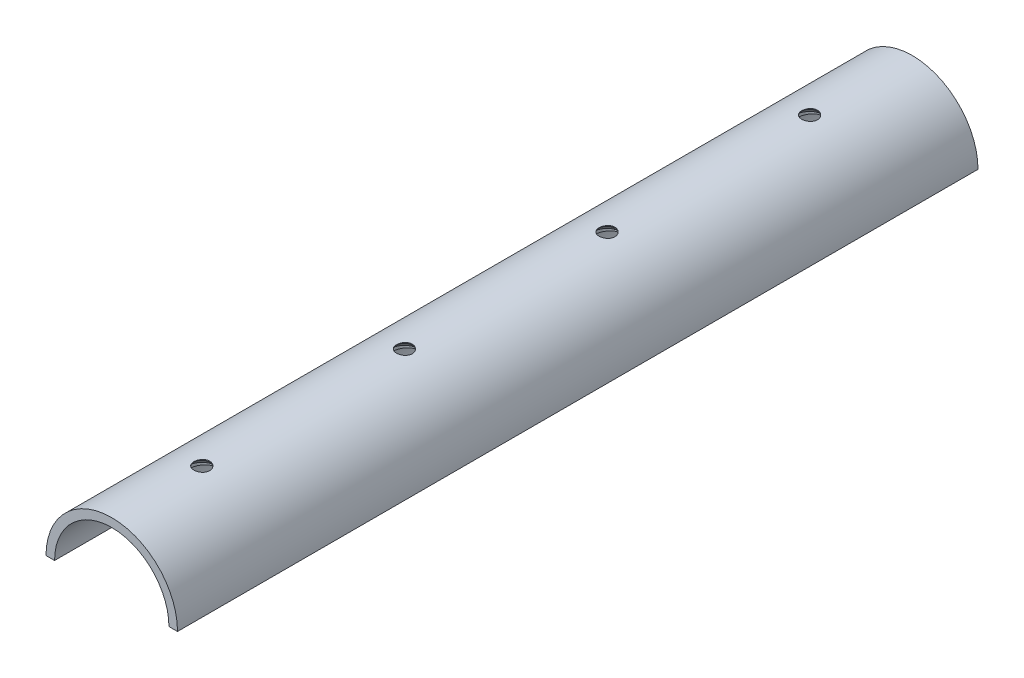
from build123d import *

# Parameters (mm, degrees)
SKETCH2_R                                      = 29.21
BOSS_EXTRUDE1_DEPTH                            = 355.6
SKETCH3_R                                      = 25.4
CUT_EXTRUDE1_DEPTH                             = 358.99135213
CUT_EXTRUDE2_REACH                             = 359.991
SKETCH4_W                                      = 58.42
SKETCH4_H                                      = 355.6
CSK_FOR_M6_FLAT_HEAD_MACHINE_SCREW1_AT_2_COUNT = 2
CSK_FOR_M6_FLAT_HEAD_MACHINE_SCREW1_AT_2_PITCH = 90
CSK_FOR_M6_FLAT_HEAD_MACHINE_SCREW1_AT_3_COUNT = 2
CSK_FOR_M6_FLAT_HEAD_MACHINE_SCREW1_AT_3_PITCH = 180
CSK_FOR_M6_FLAT_HEAD_MACHINE_SCREW1_AT_4_COUNT = 2
CSK_FOR_M6_FLAT_HEAD_MACHINE_SCREW1_AT_4_PITCH = 270


with BuildPart() as part:
    # Sketch2 → Boss-Extrude1 (new body)
    with BuildSketch(Plane.XY):
        Circle(SKETCH2_R)
    extrude(amount=-BOSS_EXTRUDE1_DEPTH)

    # Sketch3 → Cut-Extrude1 (cut, through all)
    with BuildSketch(Plane.XY):
        Circle(SKETCH3_R)
    extrude(amount=-CUT_EXTRUDE1_DEPTH, mode=Mode.SUBTRACT)

    # Sketch4 → Cut-Extrude2 (cut, up to next)
    with BuildSketch(Plane(origin=(0, 0, 0), x_dir=(1, 0, 0), z_dir=(0, 1, 0)), mode=Mode.PRIVATE) as cut_extrude2_sk1:
        with Locations((0, 177.8)):
            Rectangle(SKETCH4_W, SKETCH4_H)
    cut_extrude2_tool1 = extrude(cut_extrude2_sk1.sketch, amount=-CUT_EXTRUDE2_REACH, mode=Mode.PRIVATE) & part.part
    add(cut_extrude2_tool1.solids().sort_by_distance((0, 0, -177.8))[0], mode=Mode.SUBTRACT)

    # Sketch10 → CSK for M6 Flat Head Machine Screw1 (revolve, cut)
    with BuildSketch(Plane(origin=(0, 0, -40), x_dir=(0, 0, -1), z_dir=(1, 0, 0))):
        Polygon((0, 0), (0, 29.21), (3.5, 29.21), (3.5, 28.8), (6.3, 26), (6.3, 0), align=None)
    csk_for_m6_flat_head_machine_screw1 = revolve(axis=Axis((0, -6.35, -40), (0, 1, 0)), mode=Mode.SUBTRACT)

    # CSK for M6 Flat Head Machine Screw1 at 2: CSK for M6 Flat Head Machine Screw1 ×2
    with Locations(*[(0, 0, -i * CSK_FOR_M6_FLAT_HEAD_MACHINE_SCREW1_AT_2_PITCH) for i in range(1, CSK_FOR_M6_FLAT_HEAD_MACHINE_SCREW1_AT_2_COUNT)]):
        add(csk_for_m6_flat_head_machine_screw1, mode=Mode.SUBTRACT)

    # CSK for M6 Flat Head Machine Screw1 at 3: CSK for M6 Flat Head Machine Screw1 ×2
    with Locations(*[(0, 0, -i * CSK_FOR_M6_FLAT_HEAD_MACHINE_SCREW1_AT_3_PITCH) for i in range(1, CSK_FOR_M6_FLAT_HEAD_MACHINE_SCREW1_AT_3_COUNT)]):
        add(csk_for_m6_flat_head_machine_screw1, mode=Mode.SUBTRACT)

    # CSK for M6 Flat Head Machine Screw1 at 4: CSK for M6 Flat Head Machine Screw1 ×2
    with Locations(*[(0, 0, -i * CSK_FOR_M6_FLAT_HEAD_MACHINE_SCREW1_AT_4_PITCH) for i in range(1, CSK_FOR_M6_FLAT_HEAD_MACHINE_SCREW1_AT_4_COUNT)]):
        add(csk_for_m6_flat_head_machine_screw1, mode=Mode.SUBTRACT)


solid = part.part
